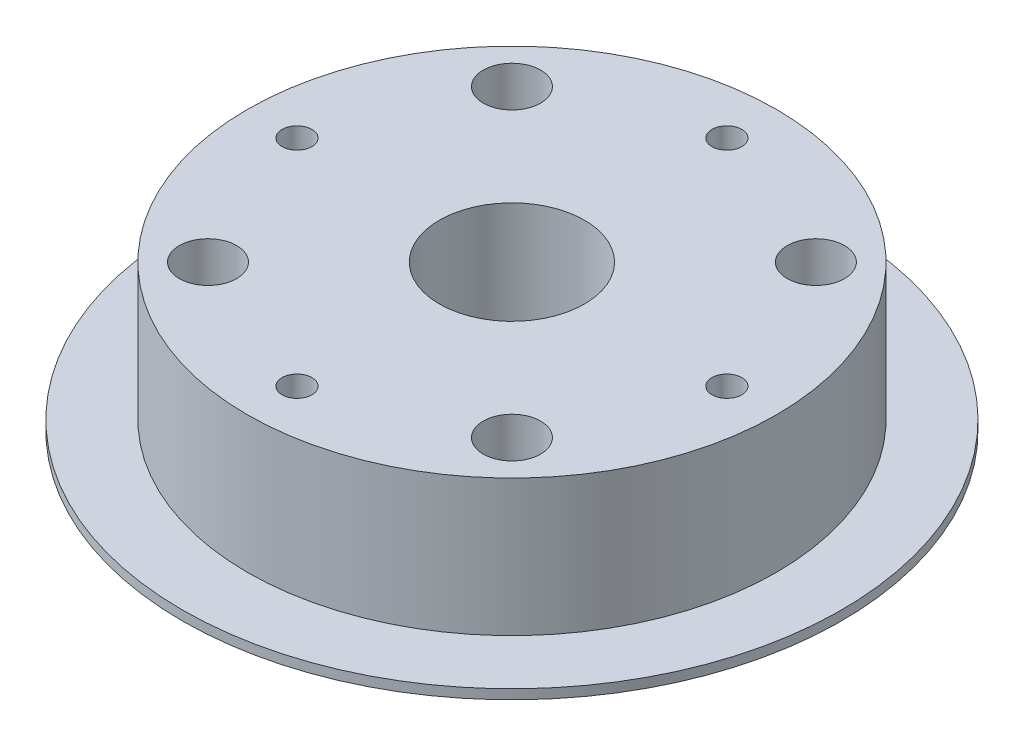
from build123d import *

# Parameters (mm, degrees)
SKETCH1_R           = 34.5
SKETCH1_R_2         = 1.5635
SKETCH1_R_3         = 7.6
BOSS_EXTRUDE1_DEPTH = 1
BOSS_EXTRUDE2_START = 14.2875
SKETCH1_3_R         = 27.69
SKETCH1_3_R_2       = 7.6
SKETCH1_3_R_3       = 1.5635
BOSS_EXTRUDE2_DEPTH = 14.2875
SKETCH2_R           = 3
SKETCH2_R_2         = 1.5635
CUT_EXTRUDE1_DEPTH  = 4.7625
CUT_EXTRUDE4_START  = -1
CUT_EXTRUDE4_DEPTH  = 4.7625


with BuildPart() as part:
    # Sketch1 → Boss-Extrude1 (new body)
    with BuildSketch(Plane(origin=(0, 0, 0), x_dir=(1, 0, 0), z_dir=(0, 1, 0))):
        Circle(SKETCH1_R)
        with Locations((22.5, 0)):
            Circle(SKETCH1_R_2, mode=Mode.SUBTRACT)
        with Locations((-15.909902577, -15.909902577)):
            Circle(SKETCH1_R_2, mode=Mode.SUBTRACT)
        with Locations((0, -22.5)):
            Circle(SKETCH1_R_2, mode=Mode.SUBTRACT)
        with Locations((15.909902577, -15.909902577)):
            Circle(SKETCH1_R_2, mode=Mode.SUBTRACT)
        with Locations((-22.5, 0)):
            Circle(SKETCH1_R_2, mode=Mode.SUBTRACT)
        with Locations((-15.909902577, 15.909902577)):
            Circle(SKETCH1_R_2, mode=Mode.SUBTRACT)
        with Locations((0, 22.5)):
            Circle(SKETCH1_R_2, mode=Mode.SUBTRACT)
        with Locations((15.909902577, 15.909902577)):
            Circle(SKETCH1_R_2, mode=Mode.SUBTRACT)
        Circle(SKETCH1_R_3, mode=Mode.SUBTRACT)
    extrude(amount=-BOSS_EXTRUDE1_DEPTH)

    # Sketch1<3> → Boss-Extrude2 (add)
    with BuildSketch(Plane(origin=(0, 0, 0), x_dir=(1, 0, 0), z_dir=(0, 1, 0)).offset(BOSS_EXTRUDE2_START)):
        Circle(SKETCH1_3_R)
        Circle(SKETCH1_3_R_2, mode=Mode.SUBTRACT)
        with Locations((-15.909902577, -15.909902577)):
            Circle(SKETCH1_3_R_3, mode=Mode.SUBTRACT)
        with Locations((0, -22.5)):
            Circle(SKETCH1_3_R_3, mode=Mode.SUBTRACT)
        with Locations((15.909902577, -15.909902577)):
            Circle(SKETCH1_3_R_3, mode=Mode.SUBTRACT)
        with Locations((-22.5, 0)):
            Circle(SKETCH1_3_R_3, mode=Mode.SUBTRACT)
        with Locations((-15.909902577, 15.909902577)):
            Circle(SKETCH1_3_R_3, mode=Mode.SUBTRACT)
        with Locations((0, 22.5)):
            Circle(SKETCH1_3_R_3, mode=Mode.SUBTRACT)
        with Locations((22.5, 0)):
            Circle(SKETCH1_3_R_3, mode=Mode.SUBTRACT)
        with Locations((15.909902577, 15.909902577)):
            Circle(SKETCH1_3_R_3, mode=Mode.SUBTRACT)
    extrude(amount=-BOSS_EXTRUDE2_DEPTH)

    # Sketch2 → Cut-Extrude1 (cut)
    # profile 1 of 4: a face of its own
    with BuildSketch(Plane(origin=(0, 14.2875, 0), x_dir=(1, 0, 0), z_dir=(0, 1, 0))):
        with Locations((15.909902577, 15.909902577)):
            Circle(SKETCH2_R)
        with Locations((15.909902577, 15.909902577)):
            Circle(SKETCH2_R_2, mode=Mode.SUBTRACT)
    # profile 2 of 4: a face of its own
    with BuildSketch(Plane(origin=(0, 14.2875, 0), x_dir=(1, 0, 0), z_dir=(0, 1, 0))):
        with Locations((15.909902577, -15.909902577)):
            Circle(SKETCH2_R)
    # profile 3 of 4: a face of its own
    with BuildSketch(Plane(origin=(0, 14.2875, 0), x_dir=(1, 0, 0), z_dir=(0, 1, 0))):
        with Locations((-15.909902577, -15.909902577)):
            Circle(SKETCH2_R)
        with Locations((-15.909902577, -15.909902577)):
            Circle(SKETCH2_R_2, mode=Mode.SUBTRACT)
    # profile 4 of 4: a face of its own
    with BuildSketch(Plane(origin=(0, 14.2875, 0), x_dir=(1, 0, 0), z_dir=(0, 1, 0))):
        with Locations((-15.909902577, 15.909902577)):
            Circle(SKETCH2_R)
        with Locations((-15.909902577, 15.909902577)):
            Circle(SKETCH2_R_2, mode=Mode.SUBTRACT)
    extrude(amount=-CUT_EXTRUDE1_DEPTH, mode=Mode.SUBTRACT)

    # Sketch4 → Cut-Extrude4 (cut)
    with BuildSketch(Plane.XZ.offset(1).offset(CUT_EXTRUDE4_START)):
        Polygon((22.5, 3.117691454), (19.8, 1.558845727), (19.8, -1.558845727), (22.5, -3.117691454), (25.2, -1.558845727), (25.2, 1.558845727), align=None)
        Polygon((1.558845727, 25.2), (-1.558845727, 25.2), (-3.117691454, 22.5), (-1.558845727, 19.8), (1.558845727, 19.8), (3.117691454, 22.5), align=None)
        Polygon((3.117691454, -22.5), (1.558845727, -19.8), (-1.558845727, -19.8), (-3.117691454, -22.5), (-1.558845727, -25.2), (1.558845727, -25.2), align=None)
        Polygon((-22.5, -3.117691454), (-19.8, -1.558845727), (-19.8, 1.558845727), (-22.5, 3.117691454), (-25.2, 1.558845727), (-25.2, -1.558845727), align=None)
    extrude(amount=-CUT_EXTRUDE4_DEPTH, mode=Mode.SUBTRACT)


solid = part.part
